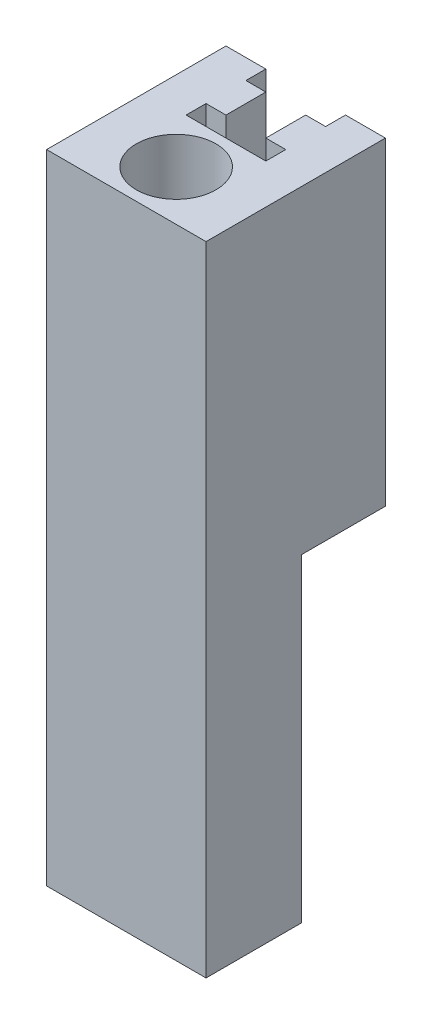
from build123d import *

# Parameters (mm, degrees)
SKETCH1_R           = 10
BOSS_EXTRUDE1_DEPTH = 160
SKETCH2_W           = 40
SKETCH2_H           = 21
CUT_EXTRUDE1_DEPTH  = 80


with BuildPart() as part:
    # Sketch1 → Boss-Extrude1 (new body)
    with BuildSketch(Plane(origin=(0, 0, 0), x_dir=(1, 0, 0), z_dir=(0, 1, 0))):
        Polygon((-10, 0), (-20, 0), (-20, -45), (20, -45), (20, 0), (10, 0), (10, -5), (5, -5), (5, -15), (10, -15), (10, -20), (-10, -20), (-10, -15), (-5, -15), (-5, -5), (-10, -5), align=None)
        with Locations((0, -32.5)):
            Circle(SKETCH1_R, mode=Mode.SUBTRACT)
    extrude(amount=-BOSS_EXTRUDE1_DEPTH)

    # Sketch2 → Cut-Extrude1 (cut)
    with BuildSketch(Plane.XZ.offset(160)):
        with Locations((0, 10.5)):
            Rectangle(SKETCH2_W, SKETCH2_H)
    extrude(amount=-CUT_EXTRUDE1_DEPTH, mode=Mode.SUBTRACT)


solid = part.part
